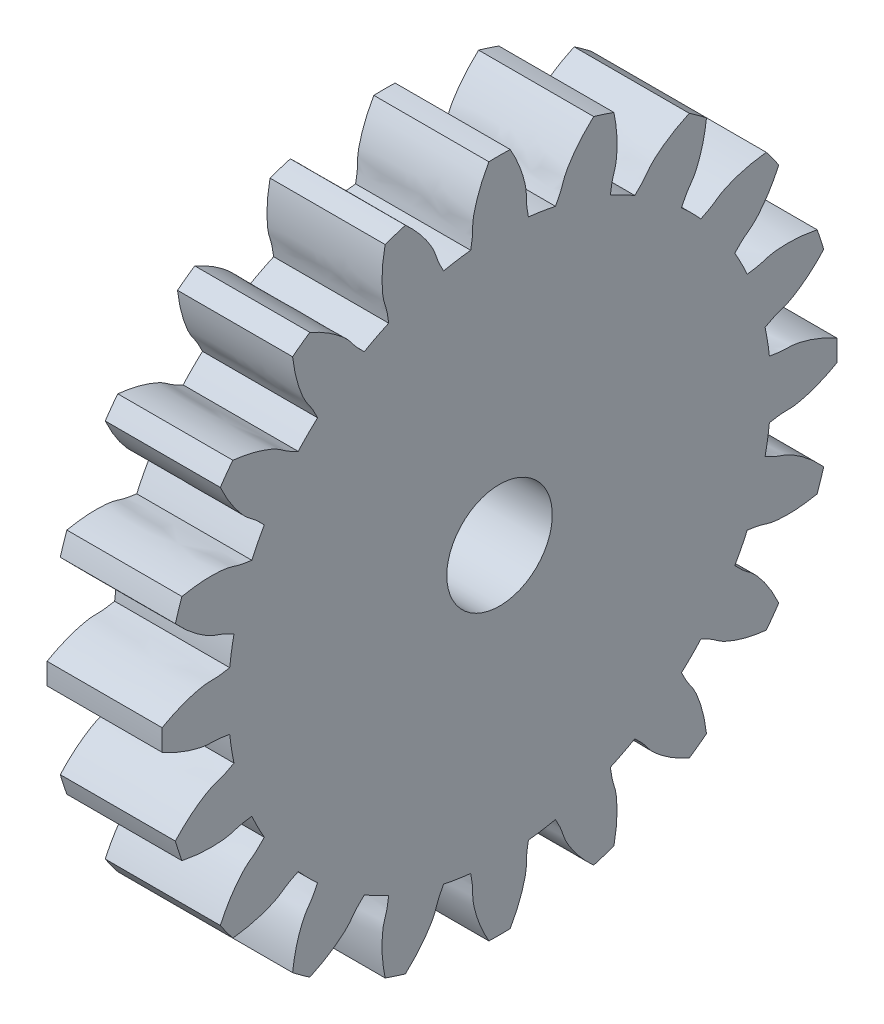
from build123d import *

# Parameters (mm, degrees)
SKETCH41_W          = 3
SKETCH41_H          = 8.8
CUT_EXTRUDE22_DEPTH = 13.801562405
CUT_EXTRUDE23_DEPTH = 13.801562566
CUT_EXTRUDE24_DEPTH = 13.801562566
CUT_EXTRUDE25_DEPTH = 13.801562566
CUT_EXTRUDE26_DEPTH = 13.801562566
CUT_EXTRUDE27_DEPTH = 13.801562566
CUT_EXTRUDE28_DEPTH = 13.801562566
CUT_EXTRUDE29_DEPTH = 13.801562566
CUT_EXTRUDE30_DEPTH = 13.801562566
CUT_EXTRUDE31_DEPTH = 13.801562566
CUT_EXTRUDE32_DEPTH = 13.801562566
CUT_EXTRUDE33_DEPTH = 13.801562566
CUT_EXTRUDE34_DEPTH = 13.801562566
CUT_EXTRUDE35_DEPTH = 13.801562566
CUT_EXTRUDE36_DEPTH = 13.801562566
CUT_EXTRUDE37_DEPTH = 13.801562566
CUT_EXTRUDE38_DEPTH = 13.801562566
CUT_EXTRUDE39_DEPTH = 13.801562566
CUT_EXTRUDE40_DEPTH = 13.801562566
CUT_EXTRUDE41_DEPTH = 13.801562566
SKETCH192_R         = 1.375
CUT_EXTRUDE42_DEPTH = 13.801562566


with BuildPart() as part:
    # Sketch41 → Revolve3 (revolve)
    with BuildSketch(Plane.XY):
        with Locations((0, 4.4)):
            Rectangle(SKETCH41_W, SKETCH41_H)
    revolve(axis=Axis((-1.5, 0, 0), (1, 0, 0)))

    # Sketch47 → Cut-Extrude22 (cut, through all)
    with BuildSketch(Plane.ZY.offset(1.5)):
        with BuildLine():
            ThreePointArc((0.752371374, 7.034278405), (1.10668029, 6.987302347), (1.458164488, 6.922491725))
            add(Edge.make_bspline(
                [(1.458164488, 6.922491725), (1.494423107, 6.992924065), (1.531449224, 7.062967764), (1.566855162, 7.133832576), (1.636353022, 7.272932207), (1.667486777, 7.42948987), (1.74037045, 7.566845723), (1.810588583, 7.699178127), (1.894945412, 7.824180822), (1.98539454, 7.943601953), (2.0778826, 8.065715114), (2.179505836, 8.181201544), (2.2870056, 8.290332043), (2.341161164, 8.34530913), (2.396825306, 8.398829506), (2.453689093, 8.451000523)],
                knots=[-0.000236866, -0.000236866, -0.000236866, -0.000236866, 0, 0, 0, 0.000466485, 0.000466485, 0.000466485, 0.000915119, 0.000915119, 0.000915119, 0.001373742, 0.001373742, 0.001373742, 0.001604528, 0.001604528, 0.001604528, 0.001604528], degree=3))
            ThreePointArc((2.453689093, 8.451000523), (1.376623292, 8.691657397), (0.27790578, 8.795610745))
            add(Edge.make_bspline(
                [(0.27790578, 8.795610745), (0.315864725, 8.728421283), (0.352265764, 8.660319215), (0.386781912, 8.591297908), (0.467849437, 8.429188674), (0.538210762, 8.260953031), (0.593124703, 8.088222586), (0.648214325, 7.914939536), (0.696810293, 7.735248583), (0.700775261, 7.553462553), (0.702846258, 7.45851138), (0.700191106, 7.362781606), (0.71430769, 7.26886283), (0.726082314, 7.190525298), (0.739651946, 7.11246809), (0.752371374, 7.034278405)],
                knots=[-0.000231043, -0.000231043, -0.000231043, -0.000231043, 0, 0, 0, 0.000543748, 0.000543748, 0.000543748, 0.001090684, 0.001090684, 0.001090684, 0.001371999, 0.001371999, 0.001371999, 0.001605449, 0.001605449, 0.001605449, 0.001605449], degree=3))
        make_face()
    extrude(amount=-CUT_EXTRUDE22_DEPTH, mode=Mode.SUBTRACT)

    # Sketch54 → Cut-Extrude23 (cut, through all)
    with BuildSketch(Plane.ZY.offset(1.5)):
        with BuildLine():
            ThreePointArc((2.889259268, 6.457500774), (3.211710672, 6.303336412), (3.525964424, 6.133083257))
            add(Edge.make_bspline(
                [(3.525964424, 6.133083257), (3.58221321, 6.188863864), (3.639071834, 6.24403768), (3.694643313, 6.300493085), (3.803723856, 6.411308676), (3.881712795, 6.550583001), (3.993474579, 6.658693887), (4.101148954, 6.762850886), (4.220005023, 6.85566782), (4.342930415, 6.941293747), (4.468626829, 7.028849882), (4.600963539, 7.107280697), (4.736925069, 7.177850716), (4.805418925, 7.213402042), (4.874897376, 7.247101779), (4.945099782, 7.279147488)],
                knots=[-0.000236866, -0.000236866, -0.000236866, -0.000236866, 0, 0, 0, 0.000466485, 0.000466485, 0.000466485, 0.000915119, 0.000915119, 0.000915119, 0.001373742, 0.001373742, 0.001373742, 0.001604513, 0.001604513, 0.001604513, 0.001604513], degree=3))
            ThreePointArc((4.945099782, 7.279147488), (3.995116398, 7.840857413), (2.982297299, 8.279245305))
            add(Edge.make_bspline(
                [(2.982297299, 8.279245305), (2.997635716, 8.203614371), (3.011210464, 8.127596915), (3.022708515, 8.051287675), (3.049713804, 7.872061389), (3.064643729, 7.690316939), (3.063493347, 7.509071182), (3.062339284, 7.32724558), (3.053029237, 7.141332348), (3.000625173, 6.967218317), (2.973253282, 6.876274412), (2.941145956, 6.786050473), (2.925549127, 6.692366146), (2.912539832, 6.614224166), (2.901324315, 6.535794103), (2.889259268, 6.457500774)],
                knots=[-0.000231057, -0.000231057, -0.000231057, -0.000231057, 0, 0, 0, 0.000543748, 0.000543748, 0.000543748, 0.001090684, 0.001090684, 0.001090684, 0.001371999, 0.001371999, 0.001371999, 0.001605449, 0.001605449, 0.001605449, 0.001605449], degree=3))
        make_face()
    extrude(amount=-CUT_EXTRUDE23_DEPTH, mode=Mode.SUBTRACT)

    # Sketch61 → Cut-Extrude24 (cut, through all)
    with BuildSketch(Plane.ZY.offset(1.5)):
        with BuildLine():
            ThreePointArc((4.743326335, 5.248617975), (5.002356435, 5.00235599), (5.248618396, 4.743325868))
            add(Edge.make_bspline(
                [(5.248618396, 4.743325868), (5.319351326, 4.778994547), (5.390476738, 4.813897683), (5.460774034, 4.850417433), (5.598759696, 4.922101581), (5.715969719, 5.030459428), (5.855669593, 5.0987427), (5.990260291, 5.164528681), (6.13198114, 5.216074285), (6.275350002, 5.259523346), (6.421950729, 5.303951851), (6.572046874, 5.337649696), (6.723161308, 5.362751349), (6.799288801, 5.375396904), (6.875780525, 5.385977237), (6.95244965, 5.39476078)],
                knots=[-0.000236866, -0.000236866, -0.000236866, -0.000236866, 0, 0, 0, 0.000466485, 0.000466485, 0.000466485, 0.000915119, 0.000915119, 0.000915119, 0.001373742, 0.001373742, 0.001373742, 0.001604513, 0.001604513, 0.001604513, 0.001604513], degree=3))
            ThreePointArc((6.95244965, 5.39476078), (6.222539674, 6.222539674), (5.39476078, 6.95244965))
            add(Edge.make_bspline(
                [(5.39476078, 6.95244965), (5.385977237, 6.875780525), (5.375396904, 6.799288801), (5.362751349, 6.723161308), (5.333050936, 6.544361887), (5.291088015, 6.366899043), (5.233985917, 6.194879573), (5.176701137, 6.022309774), (5.110396409, 5.848372746), (5.006752987, 5.698974209), (4.95261756, 5.620939794), (4.894200948, 5.545053439), (4.850417433, 5.460774034), (4.813897658, 5.390476688), (4.778994845, 5.319351051), (4.743326335, 5.248617975)],
                knots=[-0.000231043, -0.000231043, -0.000231043, -0.000231043, 0, 0, 0, 0.000543748, 0.000543748, 0.000543748, 0.001090684, 0.001090684, 0.001090684, 0.001371999, 0.001371999, 0.001371999, 0.001605449, 0.001605449, 0.001605449, 0.001605449], degree=3))
        make_face()
    extrude(amount=-CUT_EXTRUDE24_DEPTH, mode=Mode.SUBTRACT)

    # Sketch68 → Cut-Extrude25 (cut, through all)
    with BuildSketch(Plane.ZY.offset(1.5)):
        with BuildLine():
            ThreePointArc((6.133083571, 3.525963879), (6.303336698, 3.211710111), (6.457501031, 2.889258694))
            add(Edge.make_bspline(
                [(6.457501031, 2.889258694), (6.535794272, 2.901323946), (6.614224221, 2.912539841), (6.692366146, 2.925549127), (6.845749929, 2.951084889), (6.9907077, 3.017919437), (7.144670867, 3.039691052), (7.293003214, 3.060666425), (7.443716219, 3.065895056), (7.593494607, 3.062914155), (7.746649347, 3.059866057), (7.899812471, 3.045532353), (8.051287675, 3.022708515), (8.127596915, 3.011210464), (8.203614371, 2.997635716), (8.279245305, 2.982297299)],
                knots=[-0.000236866, -0.000236866, -0.000236866, -0.000236866, 0, 0, 0, 0.000466485, 0.000466485, 0.000466485, 0.000915119, 0.000915119, 0.000915119, 0.001373742, 0.001373742, 0.001373742, 0.001604528, 0.001604528, 0.001604528, 0.001604528], degree=3))
            ThreePointArc((8.279245305, 2.982297299), (7.840857413, 3.995116398), (7.279147488, 4.945099782))
            add(Edge.make_bspline(
                [(7.279147488, 4.945099782), (7.247101779, 4.874897376), (7.213402042, 4.805418925), (7.177850716, 4.736925069), (7.094351885, 4.576054646), (6.99960374, 4.420244708), (6.892139479, 4.274289989), (6.784331415, 4.127868327), (6.667522373, 3.982933671), (6.522784935, 3.872874798), (6.447185124, 3.815388426), (6.368177451, 3.76126794), (6.300493085, 3.694643313), (6.244037641, 3.639071795), (6.188864062, 3.582212857), (6.133083571, 3.525963879)],
                knots=[-0.000231043, -0.000231043, -0.000231043, -0.000231043, 0, 0, 0, 0.000543748, 0.000543748, 0.000543748, 0.001090684, 0.001090684, 0.001090684, 0.001371999, 0.001371999, 0.001371999, 0.001605449, 0.001605449, 0.001605449, 0.001605449], degree=3))
        make_face()
    extrude(amount=-CUT_EXTRUDE25_DEPTH, mode=Mode.SUBTRACT)

    # Sketch75 → Cut-Extrude26 (cut, through all)
    with BuildSketch(Plane.ZY.offset(1.5)):
        with BuildLine():
            ThreePointArc((6.922491855, 1.458163872), (6.987302446, 1.106679669), (7.034278472, 0.752370749))
            add(Edge.make_bspline(
                [(7.034278472, 0.752370749), (7.112468137, 0.739651543), (7.190525353, 0.726082306), (7.26886283, 0.71430769), (7.422630461, 0.691195446), (7.581146506, 0.709964464), (7.734301978, 0.683093265), (7.88185617, 0.657204814), (8.026808491, 0.615604659), (8.168335054, 0.566485586), (8.313051953, 0.516259255), (8.454289382, 0.455297084), (8.591297908, 0.386781912), (8.660319215, 0.352265764), (8.728421283, 0.315864725), (8.795610745, 0.27790578)],
                knots=[-0.000236866, -0.000236866, -0.000236866, -0.000236866, 0, 0, 0, 0.000466485, 0.000466485, 0.000466485, 0.000915119, 0.000915119, 0.000915119, 0.001373742, 0.001373742, 0.001373742, 0.001604513, 0.001604513, 0.001604513, 0.001604513], degree=3))
            ThreePointArc((8.795610745, 0.27790578), (8.691657397, 1.376623292), (8.451000523, 2.453689093))
            add(Edge.make_bspline(
                [(8.451000523, 2.453689093), (8.398829506, 2.396825306), (8.34530913, 2.341161164), (8.290332043, 2.2870056), (8.161208242, 2.159811294), (8.022949483, 2.040906024), (7.875642408, 1.93530312), (7.727864065, 1.829362368), (7.571984792, 1.727617298), (7.400321246, 1.667671417), (7.310657288, 1.636360256), (7.218792375, 1.609303328), (7.133832576, 1.566855162), (7.062967715, 1.531449199), (6.992924145, 1.494422709), (6.922491855, 1.458163872)],
                knots=[-0.000231043, -0.000231043, -0.000231043, -0.000231043, 0, 0, 0, 0.000543748, 0.000543748, 0.000543748, 0.001090684, 0.001090684, 0.001090684, 0.001371999, 0.001371999, 0.001371999, 0.001605449, 0.001605449, 0.001605449, 0.001605449], degree=3))
        make_face()
    extrude(amount=-CUT_EXTRUDE26_DEPTH, mode=Mode.SUBTRACT)

    # Sketch82 → Cut-Extrude27 (cut, through all)
    with BuildSketch(Plane.ZY.offset(1.5)):
        with BuildLine():
            ThreePointArc((8.451000523, -2.453689093), (8.691657397, -1.376623292), (8.795610745, -0.27790578))
            add(Edge.make_bspline(
                [(8.795610745, -0.27790578), (8.728421283, -0.315864725), (8.660319215, -0.352265764), (8.591297908, -0.386781912), (8.429188674, -0.467849437), (8.260953031, -0.538210762), (8.088222586, -0.593124703), (7.914939536, -0.648214325), (7.735248583, -0.696810293), (7.553462553, -0.700775261), (7.45851138, -0.702846258), (7.362781606, -0.700191106), (7.26886283, -0.71430769), (7.190525298, -0.726082314), (7.11246809, -0.739651946), (7.034278405, -0.752371374)],
                knots=[-0.000231043, -0.000231043, -0.000231043, -0.000231043, 0, 0, 0, 0.000543748, 0.000543748, 0.000543748, 0.001090684, 0.001090684, 0.001090684, 0.001371999, 0.001371999, 0.001371999, 0.001605449, 0.001605449, 0.001605449, 0.001605449], degree=3))
            ThreePointArc((7.034278405, -0.752371374), (6.987302347, -1.10668029), (6.922491725, -1.458164488))
            add(Edge.make_bspline(
                [(6.922491725, -1.458164488), (6.992924065, -1.494423107), (7.062967764, -1.531449224), (7.133832576, -1.566855162), (7.272932207, -1.636353022), (7.42948987, -1.667486777), (7.566845723, -1.74037045), (7.699178127, -1.810588583), (7.824180822, -1.894945412), (7.943601953, -1.98539454), (8.065715114, -2.0778826), (8.181201544, -2.179505836), (8.290332043, -2.2870056), (8.34530913, -2.341161164), (8.398829506, -2.396825306), (8.451000523, -2.453689093)],
                knots=[-0.000236866, -0.000236866, -0.000236866, -0.000236866, 0, 0, 0, 0.000466485, 0.000466485, 0.000466485, 0.000915119, 0.000915119, 0.000915119, 0.001373742, 0.001373742, 0.001373742, 0.001604513, 0.001604513, 0.001604513, 0.001604513], degree=3))
        make_face()
    extrude(amount=-CUT_EXTRUDE27_DEPTH, mode=Mode.SUBTRACT)

    # Sketch89 → Cut-Extrude28 (cut, through all)
    with BuildSketch(Plane.ZY.offset(1.5)):
        with BuildLine():
            ThreePointArc((7.279147488, -4.945099782), (7.840857413, -3.995116398), (8.279245305, -2.982297299))
            add(Edge.make_bspline(
                [(8.279245305, -2.982297299), (8.203614371, -2.997635716), (8.127596915, -3.011210464), (8.051287675, -3.022708515), (7.872061389, -3.049713804), (7.690316939, -3.064643729), (7.509071182, -3.063493347), (7.32724558, -3.062339284), (7.141332348, -3.053029237), (6.967218317, -3.000625173), (6.876274412, -2.973253282), (6.786050473, -2.941145956), (6.692366146, -2.925549127), (6.614224166, -2.912539832), (6.535794103, -2.901324315), (6.457500774, -2.889259268)],
                knots=[-0.000231057, -0.000231057, -0.000231057, -0.000231057, 0, 0, 0, 0.000543748, 0.000543748, 0.000543748, 0.001090684, 0.001090684, 0.001090684, 0.001371999, 0.001371999, 0.001371999, 0.001605449, 0.001605449, 0.001605449, 0.001605449], degree=3))
            ThreePointArc((6.457500774, -2.889259268), (6.303336412, -3.211710672), (6.133083257, -3.525964424))
            add(Edge.make_bspline(
                [(6.133083257, -3.525964424), (6.188863864, -3.58221321), (6.24403768, -3.639071834), (6.300493085, -3.694643313), (6.411308676, -3.803723856), (6.550583001, -3.881712795), (6.658693887, -3.993474579), (6.762850886, -4.101148954), (6.85566782, -4.220005023), (6.941293747, -4.342930415), (7.028849882, -4.468626829), (7.107280697, -4.600963539), (7.177850716, -4.736925069), (7.213402042, -4.805418925), (7.247101779, -4.874897376), (7.279147488, -4.945099782)],
                knots=[-0.000236866, -0.000236866, -0.000236866, -0.000236866, 0, 0, 0, 0.000466485, 0.000466485, 0.000466485, 0.000915119, 0.000915119, 0.000915119, 0.001373742, 0.001373742, 0.001373742, 0.001604513, 0.001604513, 0.001604513, 0.001604513], degree=3))
        make_face()
    extrude(amount=-CUT_EXTRUDE28_DEPTH, mode=Mode.SUBTRACT)

    # Sketch96 → Cut-Extrude29 (cut, through all)
    with BuildSketch(Plane.ZY.offset(1.5)):
        with BuildLine():
            ThreePointArc((5.39476078, -6.95244965), (6.222539674, -6.222539674), (6.95244965, -5.39476078))
            add(Edge.make_bspline(
                [(6.95244965, -5.39476078), (6.875780525, -5.385977237), (6.799288801, -5.375396904), (6.723161308, -5.362751349), (6.544361887, -5.333050936), (6.366899043, -5.291088015), (6.194879573, -5.233985917), (6.022309774, -5.176701137), (5.848372746, -5.110396409), (5.698974209, -5.006752987), (5.620939794, -4.95261756), (5.545053439, -4.894200948), (5.460774034, -4.850417433), (5.390476688, -4.813897658), (5.319351051, -4.778994845), (5.248617975, -4.743326335)],
                knots=[-0.000231043, -0.000231043, -0.000231043, -0.000231043, 0, 0, 0, 0.000543748, 0.000543748, 0.000543748, 0.001090684, 0.001090684, 0.001090684, 0.001371999, 0.001371999, 0.001371999, 0.001605449, 0.001605449, 0.001605449, 0.001605449], degree=3))
            ThreePointArc((5.248617975, -4.743326335), (5.00235599, -5.002356435), (4.743325868, -5.248618396))
            add(Edge.make_bspline(
                [(4.743325868, -5.248618396), (4.778994547, -5.319351326), (4.813897683, -5.390476738), (4.850417433, -5.460774034), (4.922101581, -5.598759696), (5.030459428, -5.715969719), (5.0987427, -5.855669593), (5.164528681, -5.990260291), (5.216074285, -6.13198114), (5.259523346, -6.275350002), (5.303951851, -6.421950729), (5.337649696, -6.572046874), (5.362751349, -6.723161308), (5.375396904, -6.799288801), (5.385977237, -6.875780525), (5.39476078, -6.95244965)],
                knots=[-0.000236866, -0.000236866, -0.000236866, -0.000236866, 0, 0, 0, 0.000466485, 0.000466485, 0.000466485, 0.000915119, 0.000915119, 0.000915119, 0.001373742, 0.001373742, 0.001373742, 0.001604513, 0.001604513, 0.001604513, 0.001604513], degree=3))
        make_face()
    extrude(amount=-CUT_EXTRUDE29_DEPTH, mode=Mode.SUBTRACT)

    # Sketch103 → Cut-Extrude30 (cut, through all)
    with BuildSketch(Plane.ZY.offset(1.5)):
        with BuildLine():
            ThreePointArc((2.982297299, -8.279245305), (3.995116398, -7.840857413), (4.945099782, -7.279147488))
            add(Edge.make_bspline(
                [(4.945099782, -7.279147488), (4.874897376, -7.247101779), (4.805418925, -7.213402042), (4.736925069, -7.177850716), (4.576054646, -7.094351885), (4.420244708, -6.99960374), (4.274289989, -6.892139479), (4.127868327, -6.784331415), (3.982933671, -6.667522373), (3.872874798, -6.522784935), (3.815388426, -6.447185124), (3.76126794, -6.368177451), (3.694643313, -6.300493085), (3.639071795, -6.244037641), (3.582212857, -6.188864062), (3.525963879, -6.133083571)],
                knots=[-0.000231043, -0.000231043, -0.000231043, -0.000231043, 0, 0, 0, 0.000543748, 0.000543748, 0.000543748, 0.001090684, 0.001090684, 0.001090684, 0.001371999, 0.001371999, 0.001371999, 0.001605449, 0.001605449, 0.001605449, 0.001605449], degree=3))
            ThreePointArc((3.525963879, -6.133083571), (3.211710111, -6.303336698), (2.889258694, -6.457501031))
            add(Edge.make_bspline(
                [(2.889258694, -6.457501031), (2.901323946, -6.535794272), (2.912539841, -6.614224221), (2.925549127, -6.692366146), (2.951084889, -6.845749929), (3.017919437, -6.9907077), (3.039691052, -7.144670867), (3.060666425, -7.293003214), (3.065895056, -7.443716219), (3.062914155, -7.593494607), (3.059866057, -7.746649347), (3.045532353, -7.899812471), (3.022708515, -8.051287675), (3.011210464, -8.127596915), (2.997635716, -8.203614371), (2.982297299, -8.279245305)],
                knots=[-0.000236866, -0.000236866, -0.000236866, -0.000236866, 0, 0, 0, 0.000466485, 0.000466485, 0.000466485, 0.000915119, 0.000915119, 0.000915119, 0.001373742, 0.001373742, 0.001373742, 0.001604528, 0.001604528, 0.001604528, 0.001604528], degree=3))
        make_face()
    extrude(amount=-CUT_EXTRUDE30_DEPTH, mode=Mode.SUBTRACT)

    # Sketch110 → Cut-Extrude31 (cut, through all)
    with BuildSketch(Plane.ZY.offset(1.5)):
        with BuildLine():
            ThreePointArc((0.27790578, -8.795610745), (1.376623292, -8.691657397), (2.453689093, -8.451000523))
            add(Edge.make_bspline(
                [(2.453689093, -8.451000523), (2.396825306, -8.398829506), (2.341161164, -8.34530913), (2.2870056, -8.290332043), (2.159811294, -8.161208242), (2.040906024, -8.022949483), (1.93530312, -7.875642408), (1.829362368, -7.727864065), (1.727617298, -7.571984792), (1.667671417, -7.400321246), (1.636360256, -7.310657288), (1.609303328, -7.218792375), (1.566855162, -7.133832576), (1.531449199, -7.062967715), (1.494422709, -6.992924145), (1.458163872, -6.922491855)],
                knots=[-0.000231057, -0.000231057, -0.000231057, -0.000231057, 0, 0, 0, 0.000543748, 0.000543748, 0.000543748, 0.001090684, 0.001090684, 0.001090684, 0.001371999, 0.001371999, 0.001371999, 0.001605449, 0.001605449, 0.001605449, 0.001605449], degree=3))
            ThreePointArc((1.458163872, -6.922491855), (1.106679669, -6.987302446), (0.752370749, -7.034278472))
            add(Edge.make_bspline(
                [(0.752370749, -7.034278472), (0.739651543, -7.112468137), (0.726082306, -7.190525353), (0.71430769, -7.26886283), (0.691195446, -7.422630461), (0.709964464, -7.581146506), (0.683093265, -7.734301978), (0.657204814, -7.88185617), (0.615604659, -8.026808491), (0.566485586, -8.168335054), (0.516259255, -8.313051953), (0.455297084, -8.454289382), (0.386781912, -8.591297908), (0.352265764, -8.660319215), (0.315864725, -8.728421283), (0.27790578, -8.795610745)],
                knots=[-0.000236866, -0.000236866, -0.000236866, -0.000236866, 0, 0, 0, 0.000466485, 0.000466485, 0.000466485, 0.000915119, 0.000915119, 0.000915119, 0.001373742, 0.001373742, 0.001373742, 0.001604513, 0.001604513, 0.001604513, 0.001604513], degree=3))
        make_face()
    extrude(amount=-CUT_EXTRUDE31_DEPTH, mode=Mode.SUBTRACT)

    # Sketch117 → Cut-Extrude32 (cut, through all)
    with BuildSketch(Plane.ZY.offset(1.5)):
        with BuildLine():
            ThreePointArc((-0.752371374, -7.034278405), (-1.10668029, -6.987302347), (-1.458164488, -6.922491725))
            add(Edge.make_bspline(
                [(-1.458164488, -6.922491725), (-1.494423107, -6.992924065), (-1.531449224, -7.062967764), (-1.566855162, -7.133832576), (-1.636353022, -7.272932207), (-1.667486777, -7.42948987), (-1.74037045, -7.566845723), (-1.810588583, -7.699178127), (-1.894945412, -7.824180822), (-1.98539454, -7.943601953), (-2.0778826, -8.065715114), (-2.179505836, -8.181201544), (-2.2870056, -8.290332043), (-2.341161164, -8.34530913), (-2.396825306, -8.398829506), (-2.453689093, -8.451000523)],
                knots=[-0.000236866, -0.000236866, -0.000236866, -0.000236866, 0, 0, 0, 0.000466485, 0.000466485, 0.000466485, 0.000915119, 0.000915119, 0.000915119, 0.001373742, 0.001373742, 0.001373742, 0.001604528, 0.001604528, 0.001604528, 0.001604528], degree=3))
            ThreePointArc((-2.453689093, -8.451000523), (-1.376623292, -8.691657397), (-0.27790578, -8.795610745))
            add(Edge.make_bspline(
                [(-0.27790578, -8.795610745), (-0.315864725, -8.728421283), (-0.352265764, -8.660319215), (-0.386781912, -8.591297908), (-0.467849437, -8.429188674), (-0.538210762, -8.260953031), (-0.593124703, -8.088222586), (-0.648214325, -7.914939536), (-0.696810293, -7.735248583), (-0.700775261, -7.553462553), (-0.702846258, -7.45851138), (-0.700191106, -7.362781606), (-0.71430769, -7.26886283), (-0.726082314, -7.190525298), (-0.739651946, -7.11246809), (-0.752371374, -7.034278405)],
                knots=[-0.000231043, -0.000231043, -0.000231043, -0.000231043, 0, 0, 0, 0.000543748, 0.000543748, 0.000543748, 0.001090684, 0.001090684, 0.001090684, 0.001371999, 0.001371999, 0.001371999, 0.001605449, 0.001605449, 0.001605449, 0.001605449], degree=3))
        make_face()
    extrude(amount=-CUT_EXTRUDE32_DEPTH, mode=Mode.SUBTRACT)

    # Sketch124 → Cut-Extrude33 (cut, through all)
    with BuildSketch(Plane.ZY.offset(1.5)):
        with BuildLine():
            ThreePointArc((-2.889259268, -6.457500774), (-3.211710672, -6.303336412), (-3.525964424, -6.133083257))
            add(Edge.make_bspline(
                [(-3.525964424, -6.133083257), (-3.58221321, -6.188863864), (-3.639071834, -6.24403768), (-3.694643313, -6.300493085), (-3.803723856, -6.411308676), (-3.881712795, -6.550583001), (-3.993474579, -6.658693887), (-4.101148954, -6.762850886), (-4.220005023, -6.85566782), (-4.342930415, -6.941293747), (-4.468626829, -7.028849882), (-4.600963539, -7.107280697), (-4.736925069, -7.177850716), (-4.805418925, -7.213402042), (-4.874897376, -7.247101779), (-4.945099782, -7.279147488)],
                knots=[-0.000236866, -0.000236866, -0.000236866, -0.000236866, 0, 0, 0, 0.000466485, 0.000466485, 0.000466485, 0.000915119, 0.000915119, 0.000915119, 0.001373742, 0.001373742, 0.001373742, 0.001604513, 0.001604513, 0.001604513, 0.001604513], degree=3))
            ThreePointArc((-4.945099782, -7.279147488), (-3.995116398, -7.840857413), (-2.982297299, -8.279245305))
            add(Edge.make_bspline(
                [(-2.982297299, -8.279245305), (-2.997635716, -8.203614371), (-3.011210464, -8.127596915), (-3.022708515, -8.051287675), (-3.049713804, -7.872061389), (-3.064643729, -7.690316939), (-3.063493347, -7.509071182), (-3.062339284, -7.32724558), (-3.053029237, -7.141332348), (-3.000625173, -6.967218317), (-2.973253282, -6.876274412), (-2.941145956, -6.786050473), (-2.925549127, -6.692366146), (-2.912539832, -6.614224166), (-2.901324315, -6.535794103), (-2.889259268, -6.457500774)],
                knots=[-0.000231057, -0.000231057, -0.000231057, -0.000231057, 0, 0, 0, 0.000543748, 0.000543748, 0.000543748, 0.001090684, 0.001090684, 0.001090684, 0.001371999, 0.001371999, 0.001371999, 0.001605449, 0.001605449, 0.001605449, 0.001605449], degree=3))
        make_face()
    extrude(amount=-CUT_EXTRUDE33_DEPTH, mode=Mode.SUBTRACT)

    # Sketch131 → Cut-Extrude34 (cut, through all)
    with BuildSketch(Plane.ZY.offset(1.5)):
        with BuildLine():
            ThreePointArc((-6.95244965, -5.39476078), (-6.222539674, -6.222539674), (-5.39476078, -6.95244965))
            add(Edge.make_bspline(
                [(-5.39476078, -6.95244965), (-5.385977237, -6.875780525), (-5.375396904, -6.799288801), (-5.362751349, -6.723161308), (-5.333050936, -6.544361887), (-5.291088015, -6.366899043), (-5.233985917, -6.194879573), (-5.176701137, -6.022309774), (-5.110396409, -5.848372746), (-5.006752987, -5.698974209), (-4.95261756, -5.620939794), (-4.894200948, -5.545053439), (-4.850417433, -5.460774034), (-4.813897658, -5.390476688), (-4.778994845, -5.319351051), (-4.743326335, -5.248617975)],
                knots=[-0.000231043, -0.000231043, -0.000231043, -0.000231043, 0, 0, 0, 0.000543748, 0.000543748, 0.000543748, 0.001090684, 0.001090684, 0.001090684, 0.001371999, 0.001371999, 0.001371999, 0.001605449, 0.001605449, 0.001605449, 0.001605449], degree=3))
            ThreePointArc((-4.743326335, -5.248617975), (-5.002356435, -5.00235599), (-5.248618396, -4.743325868))
            add(Edge.make_bspline(
                [(-5.248618396, -4.743325868), (-5.319351326, -4.778994547), (-5.390476738, -4.813897683), (-5.460774034, -4.850417433), (-5.598759696, -4.922101581), (-5.715969719, -5.030459428), (-5.855669593, -5.0987427), (-5.990260291, -5.164528681), (-6.13198114, -5.216074285), (-6.275350002, -5.259523346), (-6.421950729, -5.303951851), (-6.572046874, -5.337649696), (-6.723161308, -5.362751349), (-6.799288801, -5.375396904), (-6.875780525, -5.385977237), (-6.95244965, -5.39476078)],
                knots=[-0.000236866, -0.000236866, -0.000236866, -0.000236866, 0, 0, 0, 0.000466485, 0.000466485, 0.000466485, 0.000915119, 0.000915119, 0.000915119, 0.001373742, 0.001373742, 0.001373742, 0.001604513, 0.001604513, 0.001604513, 0.001604513], degree=3))
        make_face()
    extrude(amount=-CUT_EXTRUDE34_DEPTH, mode=Mode.SUBTRACT)

    # Sketch138 → Cut-Extrude35 (cut, through all)
    with BuildSketch(Plane.ZY.offset(1.5)):
        with BuildLine():
            ThreePointArc((-8.279245305, -2.982297299), (-7.840857413, -3.995116398), (-7.279147488, -4.945099782))
            add(Edge.make_bspline(
                [(-7.279147488, -4.945099782), (-7.247101779, -4.874897376), (-7.213402042, -4.805418925), (-7.177850716, -4.736925069), (-7.094351885, -4.576054646), (-6.99960374, -4.420244708), (-6.892139479, -4.274289989), (-6.784331415, -4.127868327), (-6.667522373, -3.982933671), (-6.522784935, -3.872874798), (-6.447185124, -3.815388426), (-6.368177451, -3.76126794), (-6.300493085, -3.694643313), (-6.244037641, -3.639071795), (-6.188864062, -3.582212857), (-6.133083571, -3.525963879)],
                knots=[-0.000231043, -0.000231043, -0.000231043, -0.000231043, 0, 0, 0, 0.000543748, 0.000543748, 0.000543748, 0.001090684, 0.001090684, 0.001090684, 0.001371999, 0.001371999, 0.001371999, 0.001605449, 0.001605449, 0.001605449, 0.001605449], degree=3))
            ThreePointArc((-6.133083571, -3.525963879), (-6.303336698, -3.211710111), (-6.457501031, -2.889258694))
            add(Edge.make_bspline(
                [(-6.457501031, -2.889258694), (-6.535794272, -2.901323946), (-6.614224221, -2.912539841), (-6.692366146, -2.925549127), (-6.845749929, -2.951084889), (-6.9907077, -3.017919437), (-7.144670867, -3.039691052), (-7.293003214, -3.060666425), (-7.443716219, -3.065895056), (-7.593494607, -3.062914155), (-7.746649347, -3.059866057), (-7.899812471, -3.045532353), (-8.051287675, -3.022708515), (-8.127596915, -3.011210464), (-8.203614371, -2.997635716), (-8.279245305, -2.982297299)],
                knots=[-0.000236866, -0.000236866, -0.000236866, -0.000236866, 0, 0, 0, 0.000466485, 0.000466485, 0.000466485, 0.000915119, 0.000915119, 0.000915119, 0.001373742, 0.001373742, 0.001373742, 0.001604528, 0.001604528, 0.001604528, 0.001604528], degree=3))
        make_face()
    extrude(amount=-CUT_EXTRUDE35_DEPTH, mode=Mode.SUBTRACT)

    # Sketch145 → Cut-Extrude36 (cut, through all)
    with BuildSketch(Plane.ZY.offset(1.5)):
        with BuildLine():
            ThreePointArc((-8.795610745, -0.27790578), (-8.691657397, -1.376623292), (-8.451000523, -2.453689093))
            add(Edge.make_bspline(
                [(-8.451000523, -2.453689093), (-8.398829506, -2.396825306), (-8.34530913, -2.341161164), (-8.290332043, -2.2870056), (-8.161208242, -2.159811294), (-8.022949483, -2.040906024), (-7.875642408, -1.93530312), (-7.727864065, -1.829362368), (-7.571984792, -1.727617298), (-7.400321246, -1.667671417), (-7.310657288, -1.636360256), (-7.218792375, -1.609303328), (-7.133832576, -1.566855162), (-7.062967715, -1.531449199), (-6.992924145, -1.494422709), (-6.922491855, -1.458163872)],
                knots=[-0.000231043, -0.000231043, -0.000231043, -0.000231043, 0, 0, 0, 0.000543748, 0.000543748, 0.000543748, 0.001090684, 0.001090684, 0.001090684, 0.001371999, 0.001371999, 0.001371999, 0.001605449, 0.001605449, 0.001605449, 0.001605449], degree=3))
            ThreePointArc((-6.922491855, -1.458163872), (-6.987302446, -1.106679669), (-7.034278472, -0.752370749))
            add(Edge.make_bspline(
                [(-7.034278472, -0.752370749), (-7.112468137, -0.739651543), (-7.190525353, -0.726082306), (-7.26886283, -0.71430769), (-7.422630461, -0.691195446), (-7.581146506, -0.709964464), (-7.734301978, -0.683093265), (-7.88185617, -0.657204814), (-8.026808491, -0.615604659), (-8.168335054, -0.566485586), (-8.313051953, -0.516259255), (-8.454289382, -0.455297084), (-8.591297908, -0.386781912), (-8.660319215, -0.352265764), (-8.728421283, -0.315864725), (-8.795610745, -0.27790578)],
                knots=[-0.000236866, -0.000236866, -0.000236866, -0.000236866, 0, 0, 0, 0.000466485, 0.000466485, 0.000466485, 0.000915119, 0.000915119, 0.000915119, 0.001373742, 0.001373742, 0.001373742, 0.001604513, 0.001604513, 0.001604513, 0.001604513], degree=3))
        make_face()
    extrude(amount=-CUT_EXTRUDE36_DEPTH, mode=Mode.SUBTRACT)

    # Sketch152 → Cut-Extrude37 (cut, through all)
    with BuildSketch(Plane.ZY.offset(1.5)):
        with BuildLine():
            ThreePointArc((-8.451000523, 2.453689093), (-8.691657397, 1.376623292), (-8.795610745, 0.27790578))
            add(Edge.make_bspline(
                [(-8.795610745, 0.27790578), (-8.728421283, 0.315864725), (-8.660319215, 0.352265764), (-8.591297908, 0.386781912), (-8.429188674, 0.467849437), (-8.260953031, 0.538210762), (-8.088222586, 0.593124703), (-7.914939536, 0.648214325), (-7.735248583, 0.696810293), (-7.553462553, 0.700775261), (-7.45851138, 0.702846258), (-7.362781606, 0.700191106), (-7.26886283, 0.71430769), (-7.190525298, 0.726082314), (-7.11246809, 0.739651946), (-7.034278405, 0.752371374)],
                knots=[-0.000231043, -0.000231043, -0.000231043, -0.000231043, 0, 0, 0, 0.000543748, 0.000543748, 0.000543748, 0.001090684, 0.001090684, 0.001090684, 0.001371999, 0.001371999, 0.001371999, 0.001605449, 0.001605449, 0.001605449, 0.001605449], degree=3))
            ThreePointArc((-7.034278405, 0.752371374), (-6.987302347, 1.10668029), (-6.922491725, 1.458164488))
            add(Edge.make_bspline(
                [(-6.922491725, 1.458164488), (-6.992924065, 1.494423107), (-7.062967764, 1.531449224), (-7.133832576, 1.566855162), (-7.272932207, 1.636353022), (-7.42948987, 1.667486777), (-7.566845723, 1.74037045), (-7.699178127, 1.810588583), (-7.824180822, 1.894945412), (-7.943601953, 1.98539454), (-8.065715114, 2.0778826), (-8.181201544, 2.179505836), (-8.290332043, 2.2870056), (-8.34530913, 2.341161164), (-8.398829506, 2.396825306), (-8.451000523, 2.453689093)],
                knots=[-0.000236866, -0.000236866, -0.000236866, -0.000236866, 0, 0, 0, 0.000466485, 0.000466485, 0.000466485, 0.000915119, 0.000915119, 0.000915119, 0.001373742, 0.001373742, 0.001373742, 0.001604513, 0.001604513, 0.001604513, 0.001604513], degree=3))
        make_face()
    extrude(amount=-CUT_EXTRUDE37_DEPTH, mode=Mode.SUBTRACT)

    # Sketch159 → Cut-Extrude38 (cut, through all)
    with BuildSketch(Plane.ZY.offset(1.5)):
        with BuildLine():
            ThreePointArc((-7.279147488, 4.945099782), (-7.840857413, 3.995116398), (-8.279245305, 2.982297299))
            add(Edge.make_bspline(
                [(-8.279245305, 2.982297299), (-8.203614371, 2.997635716), (-8.127596915, 3.011210464), (-8.051287675, 3.022708515), (-7.872061389, 3.049713804), (-7.690316939, 3.064643729), (-7.509071182, 3.063493347), (-7.32724558, 3.062339284), (-7.141332348, 3.053029237), (-6.967218317, 3.000625173), (-6.876274412, 2.973253282), (-6.786050473, 2.941145956), (-6.692366146, 2.925549127), (-6.614224166, 2.912539832), (-6.535794103, 2.901324315), (-6.457500774, 2.889259268)],
                knots=[-0.000231057, -0.000231057, -0.000231057, -0.000231057, 0, 0, 0, 0.000543748, 0.000543748, 0.000543748, 0.001090684, 0.001090684, 0.001090684, 0.001371999, 0.001371999, 0.001371999, 0.001605449, 0.001605449, 0.001605449, 0.001605449], degree=3))
            ThreePointArc((-6.457500774, 2.889259268), (-6.303336412, 3.211710672), (-6.133083257, 3.525964424))
            add(Edge.make_bspline(
                [(-6.133083257, 3.525964424), (-6.188863864, 3.58221321), (-6.24403768, 3.639071834), (-6.300493085, 3.694643313), (-6.411308676, 3.803723856), (-6.550583001, 3.881712795), (-6.658693887, 3.993474579), (-6.762850886, 4.101148954), (-6.85566782, 4.220005023), (-6.941293747, 4.342930415), (-7.028849882, 4.468626829), (-7.107280697, 4.600963539), (-7.177850716, 4.736925069), (-7.213402042, 4.805418925), (-7.247101779, 4.874897376), (-7.279147488, 4.945099782)],
                knots=[-0.000236866, -0.000236866, -0.000236866, -0.000236866, 0, 0, 0, 0.000466485, 0.000466485, 0.000466485, 0.000915119, 0.000915119, 0.000915119, 0.001373742, 0.001373742, 0.001373742, 0.001604513, 0.001604513, 0.001604513, 0.001604513], degree=3))
        make_face()
    extrude(amount=-CUT_EXTRUDE38_DEPTH, mode=Mode.SUBTRACT)

    # Sketch166 → Cut-Extrude39 (cut, through all)
    with BuildSketch(Plane.ZY.offset(1.5)):
        with BuildLine():
            ThreePointArc((-5.39476078, 6.95244965), (-6.222539674, 6.222539674), (-6.95244965, 5.39476078))
            add(Edge.make_bspline(
                [(-6.95244965, 5.39476078), (-6.875780525, 5.385977237), (-6.799288801, 5.375396904), (-6.723161308, 5.362751349), (-6.544361887, 5.333050936), (-6.366899043, 5.291088015), (-6.194879573, 5.233985917), (-6.022309774, 5.176701137), (-5.848372746, 5.110396409), (-5.698974209, 5.006752987), (-5.620939794, 4.95261756), (-5.545053439, 4.894200948), (-5.460774034, 4.850417433), (-5.390476688, 4.813897658), (-5.319351051, 4.778994845), (-5.248617975, 4.743326335)],
                knots=[-0.000231043, -0.000231043, -0.000231043, -0.000231043, 0, 0, 0, 0.000543748, 0.000543748, 0.000543748, 0.001090684, 0.001090684, 0.001090684, 0.001371999, 0.001371999, 0.001371999, 0.001605449, 0.001605449, 0.001605449, 0.001605449], degree=3))
            ThreePointArc((-5.248617975, 4.743326335), (-5.00235599, 5.002356435), (-4.743325868, 5.248618396))
            add(Edge.make_bspline(
                [(-4.743325868, 5.248618396), (-4.778994547, 5.319351326), (-4.813897683, 5.390476738), (-4.850417433, 5.460774034), (-4.922101581, 5.598759696), (-5.030459428, 5.715969719), (-5.0987427, 5.855669593), (-5.164528681, 5.990260291), (-5.216074285, 6.13198114), (-5.259523346, 6.275350002), (-5.303951851, 6.421950729), (-5.337649696, 6.572046874), (-5.362751349, 6.723161308), (-5.375396904, 6.799288801), (-5.385977237, 6.875780525), (-5.39476078, 6.95244965)],
                knots=[-0.000236866, -0.000236866, -0.000236866, -0.000236866, 0, 0, 0, 0.000466485, 0.000466485, 0.000466485, 0.000915119, 0.000915119, 0.000915119, 0.001373742, 0.001373742, 0.001373742, 0.001604513, 0.001604513, 0.001604513, 0.001604513], degree=3))
        make_face()
    extrude(amount=-CUT_EXTRUDE39_DEPTH, mode=Mode.SUBTRACT)

    # Sketch173 → Cut-Extrude40 (cut, through all)
    with BuildSketch(Plane.ZY.offset(1.5)):
        with BuildLine():
            ThreePointArc((-2.982297299, 8.279245305), (-3.995116398, 7.840857413), (-4.945099782, 7.279147488))
            add(Edge.make_bspline(
                [(-4.945099782, 7.279147488), (-4.874897376, 7.247101779), (-4.805418925, 7.213402042), (-4.736925069, 7.177850716), (-4.576054646, 7.094351885), (-4.420244708, 6.99960374), (-4.274289989, 6.892139479), (-4.127868327, 6.784331415), (-3.982933671, 6.667522373), (-3.872874798, 6.522784935), (-3.815388426, 6.447185124), (-3.76126794, 6.368177451), (-3.694643313, 6.300493085), (-3.639071795, 6.244037641), (-3.582212857, 6.188864062), (-3.525963879, 6.133083571)],
                knots=[-0.000231043, -0.000231043, -0.000231043, -0.000231043, 0, 0, 0, 0.000543748, 0.000543748, 0.000543748, 0.001090684, 0.001090684, 0.001090684, 0.001371999, 0.001371999, 0.001371999, 0.001605449, 0.001605449, 0.001605449, 0.001605449], degree=3))
            ThreePointArc((-3.525963879, 6.133083571), (-3.211710111, 6.303336698), (-2.889258694, 6.457501031))
            add(Edge.make_bspline(
                [(-2.889258694, 6.457501031), (-2.901323946, 6.535794272), (-2.912539841, 6.614224221), (-2.925549127, 6.692366146), (-2.951084889, 6.845749929), (-3.017919437, 6.9907077), (-3.039691052, 7.144670867), (-3.060666425, 7.293003214), (-3.065895056, 7.443716219), (-3.062914155, 7.593494607), (-3.059866057, 7.746649347), (-3.045532353, 7.899812471), (-3.022708515, 8.051287675), (-3.011210464, 8.127596915), (-2.997635716, 8.203614371), (-2.982297299, 8.279245305)],
                knots=[-0.000236866, -0.000236866, -0.000236866, -0.000236866, 0, 0, 0, 0.000466485, 0.000466485, 0.000466485, 0.000915119, 0.000915119, 0.000915119, 0.001373742, 0.001373742, 0.001373742, 0.001604528, 0.001604528, 0.001604528, 0.001604528], degree=3))
        make_face()
    extrude(amount=-CUT_EXTRUDE40_DEPTH, mode=Mode.SUBTRACT)

    # Sketch180 → Cut-Extrude41 (cut, through all)
    with BuildSketch(Plane.ZY.offset(1.5)):
        with BuildLine():
            ThreePointArc((-0.27790578, 8.795610745), (-1.376623292, 8.691657397), (-2.453689093, 8.451000523))
            add(Edge.make_bspline(
                [(-2.453689093, 8.451000523), (-2.396825306, 8.398829506), (-2.341161164, 8.34530913), (-2.2870056, 8.290332043), (-2.159811294, 8.161208242), (-2.040906024, 8.022949483), (-1.93530312, 7.875642408), (-1.829362368, 7.727864065), (-1.727617298, 7.571984792), (-1.667671417, 7.400321246), (-1.636360256, 7.310657288), (-1.609303328, 7.218792375), (-1.566855162, 7.133832576), (-1.531449199, 7.062967715), (-1.494422709, 6.992924145), (-1.458163872, 6.922491855)],
                knots=[-0.000231057, -0.000231057, -0.000231057, -0.000231057, 0, 0, 0, 0.000543748, 0.000543748, 0.000543748, 0.001090684, 0.001090684, 0.001090684, 0.001371999, 0.001371999, 0.001371999, 0.001605449, 0.001605449, 0.001605449, 0.001605449], degree=3))
            ThreePointArc((-1.458163872, 6.922491855), (-1.106679669, 6.987302446), (-0.752370749, 7.034278472))
            add(Edge.make_bspline(
                [(-0.752370749, 7.034278472), (-0.739651543, 7.112468137), (-0.726082306, 7.190525353), (-0.71430769, 7.26886283), (-0.691195446, 7.422630461), (-0.709964464, 7.581146506), (-0.683093265, 7.734301978), (-0.657204814, 7.88185617), (-0.615604659, 8.026808491), (-0.566485586, 8.168335054), (-0.516259255, 8.313051953), (-0.455297084, 8.454289382), (-0.386781912, 8.591297908), (-0.352265764, 8.660319215), (-0.315864725, 8.728421283), (-0.27790578, 8.795610745)],
                knots=[-0.000236866, -0.000236866, -0.000236866, -0.000236866, 0, 0, 0, 0.000466485, 0.000466485, 0.000466485, 0.000915119, 0.000915119, 0.000915119, 0.001373742, 0.001373742, 0.001373742, 0.001604513, 0.001604513, 0.001604513, 0.001604513], degree=3))
        make_face()
    extrude(amount=-CUT_EXTRUDE41_DEPTH, mode=Mode.SUBTRACT)

    # Sketch192 → Cut-Extrude42 (cut, through all)
    with BuildSketch(Plane.ZY.offset(1.5)):
        Circle(SKETCH192_R)
    extrude(amount=-CUT_EXTRUDE42_DEPTH, mode=Mode.SUBTRACT)


solid = part.part
